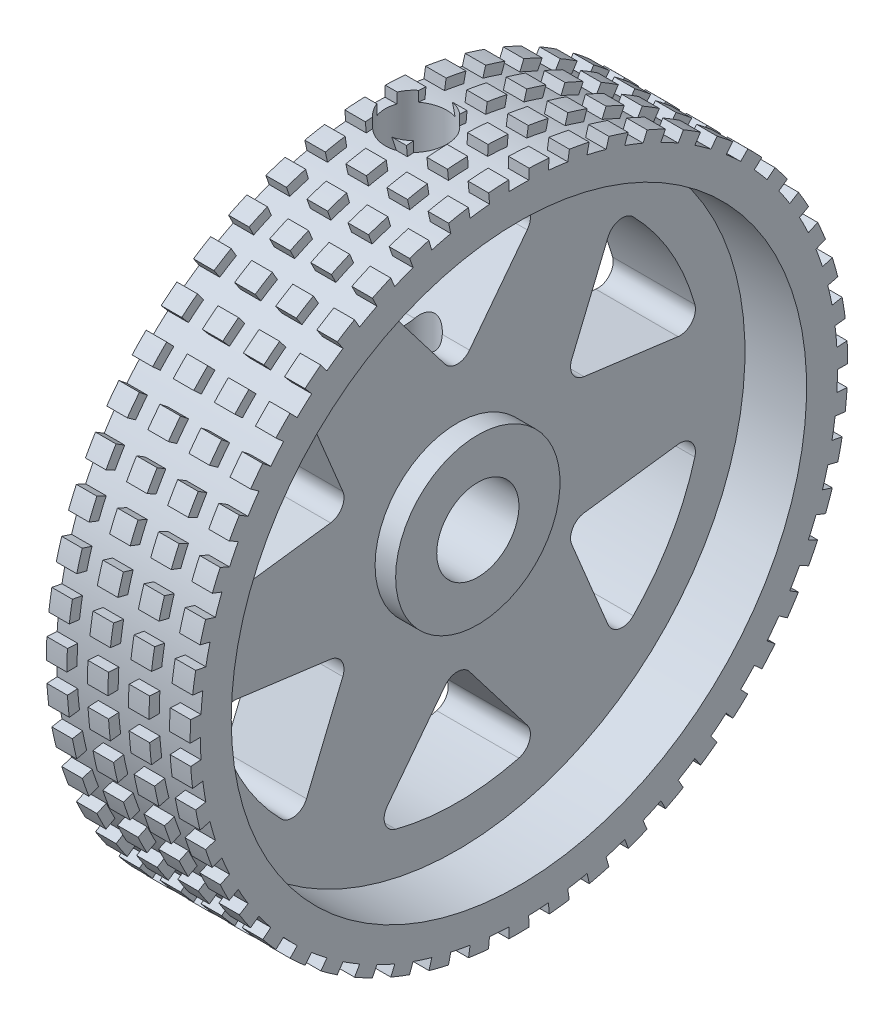
from build123d import *
from build123d.topology import SkipClean

# Parameters (mm, degrees)
CUT_EXTRUDE1_DEPTH = 23.978250761
CIRPATTERN1_COUNT  = 6
SKETCH4_W          = 1
SKETCH4_H          = 0.5
SKETCH6_W          = 7.018540652
SKETCH6_H          = 0.5
CUT_REVOLVE3_ANGLE = 3.55
LPATTERN1_COUNT    = 3
LPATTERN1_PITCH    = 2
CIRPATTERN2_COUNT  = 51


with BuildPart() as part:
    # Sketch1 → Revolve1 (revolve)
    with BuildSketch(Plane.XY, mode=Mode.PRIVATE) as revolve1_sk:
        Polygon((4, 4), (4, 14), (7, 14), (7, 16), (0, 16), (0, 2), (5, 2), (5, 4), align=None)
    revolve(revolve1_sk.sketch.rotate(Axis((0, 0, 0), (1, 0, 0)), 90), axis=Axis((0, 0, 0), (1, 0, 0)))

    # Sketch2 → Cut-Revolve1 (revolve, cut)
    with BuildSketch(Plane.XY, mode=Mode.PRIVATE) as cut_revolve1_sk:
        Polygon((2, 0), (2, 16), (3.5, 16), (3.5, 11.5), (2.9, 11.5), (2.9, 0), align=None)
    revolve(cut_revolve1_sk.sketch.rotate(Axis((2, 0, 0), (0, 1, 0)), 90), axis=Axis((2, 0, 0), (0, 1, 0)), mode=Mode.SUBTRACT)

    # Sketch3 → Cut-Extrude1 (cut, through all)
    with BuildSketch(Plane(origin=(4, 0, 0), x_dir=(0, 0, -1), z_dir=(1, 0, 0))):
        with BuildLine():
            Line((-0.595015005, 6.775438652), (-3.404590853, 10.436949184))
            ThreePointArc((-3.404590853, 10.436949184), (-3.51863405, 11.137930702), (-2.996880904, 11.619754939))
            ThreePointArc((-2.996880904, 11.619754939), (0, 12), (2.996880904, 11.619754939))
            ThreePointArc((2.996880904, 11.619754939), (3.51863405, 11.137930702), (3.404590853, 10.436949184))
            Line((3.404590853, 10.436949184), (0.595015005, 6.775438652))
            ThreePointArc((0.595015005, 6.775438652), (0, 6.482009724), (-0.595015005, 6.775438652))
        make_face()
    cut_extrude1 = extrude(amount=-CUT_EXTRUDE1_DEPTH, mode=Mode.SUBTRACT)

    # CirPattern1: Cut-Extrude1 ×6 about axis
    cirpattern1_axis = Axis((0, 0, 0), (1, 0, 0))
    for i in range(1, CIRPATTERN1_COUNT):
        add(cut_extrude1.rotate(cirpattern1_axis, i * 360 / CIRPATTERN1_COUNT), mode=Mode.SUBTRACT)

    # Sketch4 → Cut-Revolve2 (revolve, cut)
    with BuildSketch(Plane.XY, mode=Mode.PRIVATE) as cut_revolve2_sk:
        with Locations((5.5, 15.75)):
            Rectangle(SKETCH4_W, SKETCH4_H)
    cut_revolve2 = revolve(cut_revolve2_sk.sketch.rotate(Axis((0, 0, 0), (-1, 0, 0)), 270), axis=Axis((0, 0, 0), (-1, 0, 0)), mode=Mode.SUBTRACT)

    # Sketch6 → Cut-Revolve3 (revolve, symmetric, cut)
    with SkipClean():  # the faces are left unmerged after this step: merging them gives an invalid solid
        with BuildSketch(Plane.XY) as cut_revolve3_sk:
            with Locations((3.509270326, 15.75)):
                Rectangle(SKETCH6_W, SKETCH6_H)
        cut_revolve3 = revolve(axis=Axis((0, 0, 0), (-1, 0, 0)), revolution_arc=CUT_REVOLVE3_ANGLE / 2, mode=Mode.SUBTRACT)
        cut_revolve3 = cut_revolve3 + revolve(cut_revolve3_sk.sketch, axis=Axis((0, 0, 0), (1, 0, 0)), revolution_arc=CUT_REVOLVE3_ANGLE / 2, mode=Mode.SUBTRACT)

    # LPattern1: Cut-Revolve2 ×3
    with SkipClean():  # the faces are left unmerged after this step: merging them gives an invalid solid
        with Locations(*[(-i * LPATTERN1_PITCH, 0, 0) for i in range(1, LPATTERN1_COUNT)]):
            add(cut_revolve2, mode=Mode.SUBTRACT)

    # CirPattern2: Cut-Revolve3 ×51 about axis
    with SkipClean():  # the faces are left unmerged after this step: merging them gives an invalid solid
        cirpattern2_axis = Axis((0, 0, 0), (1, 0, 0))
        for i in range(1, CIRPATTERN2_COUNT):
            add(cut_revolve3.rotate(cirpattern2_axis, i * 360 / CIRPATTERN2_COUNT), mode=Mode.SUBTRACT)


solid = part.part
